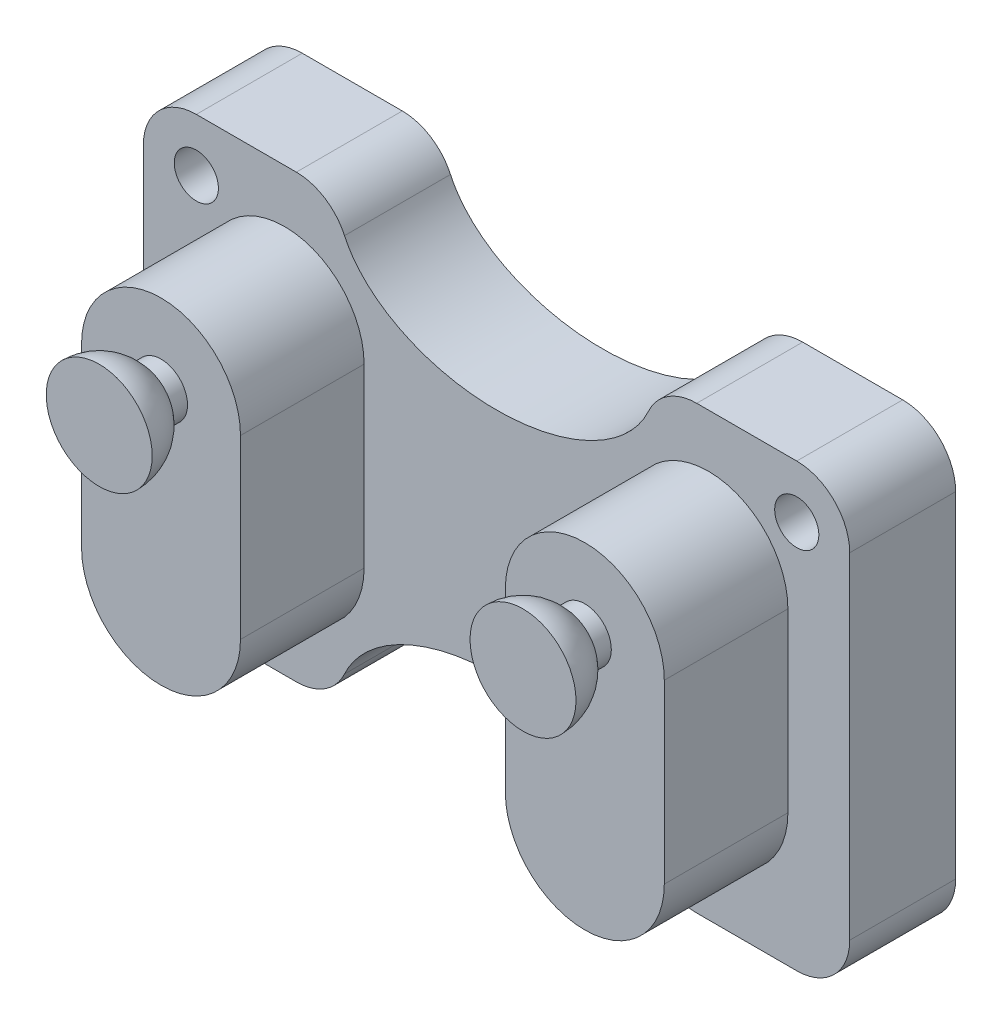
from build123d import *

# Parameters (mm, degrees)
SKIZZE1_W                       = 40
SKIZZE1_H                       = 25
AUFSATZ_LINEAR_AUSTRAGEN1_DEPTH = 6
AUFSATZ_LINEAR_AUSTRAGEN2_DEPTH = 7
SKIZZE3_R                       = 1.5
AUFSATZ_LINEAR_AUSTRAGEN3_DEPTH = 3.5
ROTATION1_ANGLE                 = 180
VERRUNDUNG1_R                   = 3
SKIZZE6_RX                      = 9
SKIZZE6_RY                      = 6
SCHNITT_LINEAR_AUSTRAGEN7_DEPTH = 6
VERRUNDUNG2_START               = -1
VERRUNDUNG2_DEPTH               = 8
VERRUNDUNG3_START               = -1
VERRUNDUNG3_DEPTH               = 8
SKIZZE7_R                       = 1.25
SCHNITT_LINEAR_AUSTRAGEN8_DEPTH = 6


with BuildPart() as part:
    # Skizze1 → Aufsatz-Linear austragen1 (new body)
    with BuildSketch(Plane.XY):
        with Locations((20, 12.5)):
            Rectangle(SKIZZE1_W, SKIZZE1_H)
    extrude(amount=AUFSATZ_LINEAR_AUSTRAGEN1_DEPTH)

    # Skizze2 → Aufsatz-Linear austragen2 (add)
    with BuildSketch(Plane.XY.offset(6)):
        with BuildLine():
            Line((12.5, 17.5), (12.5, 7.5))
            ThreePointArc((12.5, 7.5), (8, 3), (3.5, 7.5))
            Line((3.5, 7.5), (3.5, 17.5))
            ThreePointArc((3.5, 17.5), (8, 22), (12.5, 17.5))
        make_face()
    aufsatz_linear_austragen2 = extrude(amount=AUFSATZ_LINEAR_AUSTRAGEN2_DEPTH)

    # Spiegeln1: Aufsatz-Linear austragen2 across plane
    add(aufsatz_linear_austragen2.mirror(Plane.ZY.offset(-20)))

    # Skizze3 → Aufsatz-Linear austragen3 (add)
    with BuildSketch(Plane.XY.offset(13)):
        with Locations((8, 17.5)):
            Circle(SKIZZE3_R)
    aufsatz_linear_austragen3 = extrude(amount=AUFSATZ_LINEAR_AUSTRAGEN3_DEPTH)

    # Spiegeln2: Aufsatz-Linear austragen3 across plane
    add(aufsatz_linear_austragen3.mirror(Plane.ZY.offset(-20)))

    # Skizze4 → Rotation1 (revolve)
    with BuildSketch(Plane.XY.offset(16.5)):
        with BuildLine():
            Line((5, 17.5), (11, 17.5))
            ThreePointArc((11, 17.5), (8, 14.5), (5, 17.5))
        make_face()
    rotation1 = revolve(axis=Axis((5, 17.5, 16.5), (1, 0, 0)), revolution_arc=ROTATION1_ANGLE)

    # Spiegeln3: Rotation1 across plane
    add(rotation1.mirror(Plane.ZY.offset(-20)))

    # Verrundung1
    verrundung1_edges = [part.edges().sort_by_distance(p)[0] for p in [
        (0, 25, 3),
        (40, 25, 3),
        (40, 0, 3),
        (0, 0, 3),
    ]]
    fillet(verrundung1_edges, radius=VERRUNDUNG1_R)

    # Skizze6 → Schnitt-Linear austragen7 (cut)
    with BuildSketch(Plane.XY.offset(6)):
        with Locations(Location((20, 0), (0, 0, 180))):
            Ellipse(SKIZZE6_RX, SKIZZE6_RY)
    schnitt_linear_austragen7 = extrude(amount=-SCHNITT_LINEAR_AUSTRAGEN7_DEPTH, mode=Mode.SUBTRACT)

    # Verrundung2: read off the stored shape, not the designer's step
    # Verrundung2 outline → Verrundung2 (cut)
    with BuildSketch(Plane.XY.offset(VERRUNDUNG2_START)):
        with BuildLine():
            add(Edge.make_bspline(
                [(11.391923436, 1.751319232), (11, 0.89515019), (11, 0)],
                knots=[5.971053557, 5.971053557, 5.971053557, 6.283185307, 6.283185307, 6.283185307], degree=2, weights=[0.906728811, 0.94179941, 1]))
            ThreePointArc((11.391923436, 1.751319232), (10.28493687, 0.475515666), (8.664141124, 0))
            Line((8.664141124, 0), (11, 0))
        make_face()
        with BuildLine():
            ThreePointArc((31.335858876, 0), (29.71506313, 0.475515666), (28.608076564, 1.751319232))
            add(Edge.make_bspline(
                [(29, 0), (29, 0.89515019), (28.608076564, 1.751319232)],
                knots=[3.141592654, 3.141592654, 3.141592654, 3.453724403, 3.453724403, 3.453724403], degree=2, weights=[1, 0.94179941, 0.906728811]))
            Line((29, 0), (31.335858876, 0))
        make_face()
    extrude(amount=VERRUNDUNG2_DEPTH, mode=Mode.SUBTRACT)

    # Spiegeln5: Schnitt-Linear austragen7 across plane
    add(schnitt_linear_austragen7.mirror(Plane.ZX.offset(12.5)), mode=Mode.SUBTRACT)

    # Verrundung3: read off the stored shape, not the designer's step
    # Verrundung3 outline → Verrundung3 (cut)
    with BuildSketch(Plane.XY.offset(VERRUNDUNG3_START)):
        with BuildLine():
            ThreePointArc((8.664141124, 25), (10.28493687, 24.524484334), (11.391923436, 23.248680768))
            add(Edge.make_bspline(
                [(11.391923436, 23.248680768), (11, 24.10484981), (11, 25)],
                knots=[5.971053557, 5.971053557, 5.971053557, 6.283185307, 6.283185307, 6.283185307], degree=2, weights=[0.906728811, 0.94179941, 1]))
            Line((11, 25), (8.664141124, 25))
        make_face()
        with BuildLine():
            ThreePointArc((28.608076564, 23.248680768), (29.71506313, 24.524484334), (31.335858876, 25))
            Line((31.335858876, 25), (29, 25))
            add(Edge.make_bspline(
                [(29, 25), (29, 24.10484981), (28.608076564, 23.248680768)],
                knots=[3.141592654, 3.141592654, 3.141592654, 3.453724403, 3.453724403, 3.453724403], degree=2, weights=[1, 0.94179941, 0.906728811]))
        make_face()
    extrude(amount=VERRUNDUNG3_DEPTH, mode=Mode.SUBTRACT)

    # Skizze7 → Schnitt-Linear austragen8 (cut)
    with BuildSketch(Plane.XY.offset(6)):
        with Locations((3, 22)):
            Circle(SKIZZE7_R)
    schnitt_linear_austragen8 = extrude(amount=-SCHNITT_LINEAR_AUSTRAGEN8_DEPTH, mode=Mode.SUBTRACT)

    # Spiegeln6: Schnitt-Linear austragen8 across plane
    add(schnitt_linear_austragen8.mirror(Plane.ZY.offset(-20)), mode=Mode.SUBTRACT)


solid = part.part
